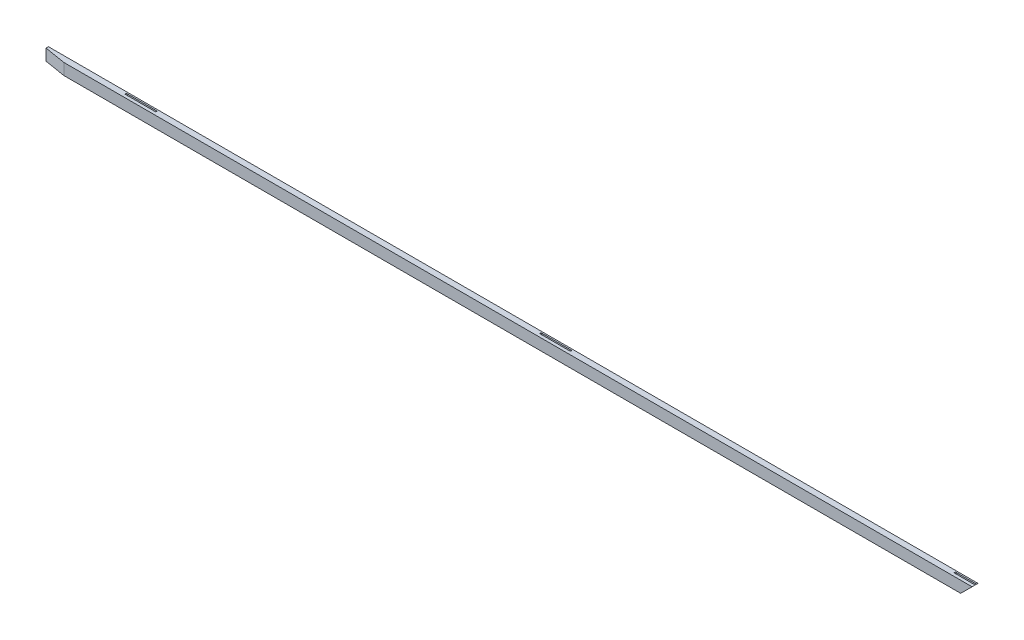
from build123d import *

# Parameters (mm, degrees)
EXTRUDE_1_DEPTH        = 25
SKETCH_2_W             = 115
SKETCH_2_H             = 6
CUT_EXTRUDE_1_DEPTH    = 7.5
DRAFT_1_ANGLE          = 45
MIRROR_START           = 6
MIRROR_1_DEPTH         = 6
PATTERN_START          = 6
PATTERN_LINEAR_1_DEPTH = 6
CUT_EXTRUDE_START      = -13
CUT_EXTRUDE_2_DEPTH    = 6
CUT_EXTRUDE_3_REACH    = 3925.373


# Read off the part's stored shape, not the designer's step: 镜向1, 阵列(线性)1
with BuildPart() as part:
    # 草图1 → 凸台-拉伸1 (new body)
    with BuildSketch(Plane.XY):
        Polygon((0, 24), (0, -24), (3875, -24), (3923, 24), align=None)
    extrude(amount=EXTRUDE_1_DEPTH)

    # 草图2 → 切除-拉伸1 (cut)
    with BuildSketch(Plane.XZ.offset(24)):
        with Locations((2150, 9)):
            Rectangle(SKETCH_2_W, SKETCH_2_H)
    extrude(amount=-CUT_EXTRUDE_1_DEPTH, mode=Mode.SUBTRACT)

    # 拔模1
    draft_1_faces = [part.faces().sort_by_distance(p)[0] for p in [
        (2207.5, -20.25, 9),
        (2092.5, -20.25, 9),
    ]]
    draft(draft_1_faces, Plane(origin=(0, -16.5, 0), x_dir=(0, 0, -1), z_dir=(0, -1, 0)), DRAFT_1_ANGLE)

    # 镜向1 outline → 镜向1 (cut)
    with BuildSketch(Plane.XY.offset(MIRROR_START)):
        Polygon((2092.5, 16.5), (2207.5, 16.5), (2215, 24), (2085, 24), align=None)
    extrude(amount=MIRROR_1_DEPTH, mode=Mode.SUBTRACT)

    # 阵列(线性)1 outline → 阵列(线性)1 (cut)
    with BuildSketch(Plane.XY.offset(PATTERN_START)):
        Polygon((457.5, 16.5), (465, 24), (335, 24), (342.5, 16.5), align=None)
        Polygon((465, -24), (457.5, -16.5), (342.5, -16.5), (335, -24), align=None)
    extrude(amount=PATTERN_LINEAR_1_DEPTH, mode=Mode.SUBTRACT)

    # 草图4 → 切除-拉伸2 (cut)
    with BuildSketch(Plane.XY.offset(25).offset(CUT_EXTRUDE_START)):
        Polygon((3833.5, 24), (3841, 16.5), (3915.5, 16.5), (3923, 24), align=None)
        Polygon((3833.5, -24), (3841, -16.5), (3882.5, -16.5), (3875, -24), align=None)
    extrude(amount=-CUT_EXTRUDE_2_DEPTH, mode=Mode.SUBTRACT)

    # 草图5 → 切除-拉伸3 (cut, up to next)
    with BuildSketch(Plane.XZ.offset(24), mode=Mode.PRIVATE) as cut_extrude_3_sk1:
        Polygon((0, 10), (90, 25), (0, 25), align=None)
    cut_extrude_3_tool1 = extrude(cut_extrude_3_sk1.sketch, amount=-CUT_EXTRUDE_3_REACH, mode=Mode.PRIVATE) & part.part
    add(cut_extrude_3_tool1.solids().sort_by_distance((30, -24, 20))[0], mode=Mode.SUBTRACT)


solid = part.part
